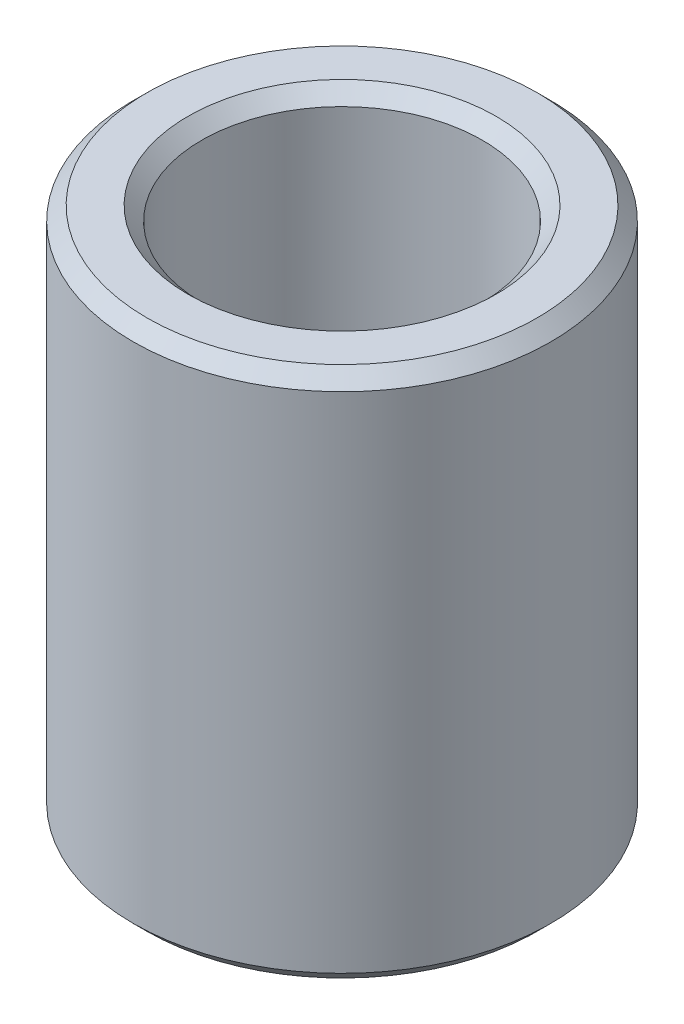
from build123d import *

# Parameters (mm, degrees)
SKETCH1_R           = 10
BOSS_EXTRUDE1_DEPTH = 25.432357876
SKETCH2_R           = 6.719081338
CUT_EXTRUDE1_DEPTH  = 30.099911119
CHAMFER1_SIZE       = 0.659512166


with BuildPart() as part:
    # Sketch1 → Boss-Extrude1 (new body)
    with BuildSketch(Plane(origin=(0, 0, 0), x_dir=(1, 0, 0), z_dir=(0, 1, 0))):
        Circle(SKETCH1_R)
    extrude(amount=BOSS_EXTRUDE1_DEPTH)

    # Sketch2 → Cut-Extrude1 (cut, through all)
    with BuildSketch(Plane(origin=(0, 0, 0), x_dir=(1, 0, 0), z_dir=(0, 1, 0))):
        Circle(SKETCH2_R)
    extrude(amount=CUT_EXTRUDE1_DEPTH, mode=Mode.SUBTRACT)

    # Chamfer1
    chamfer1_edges = [part.edges().sort_by_distance(p)[0] for p in [
        (-6.719081338, 25.432357876, 0),
        (-6.719081338, 0, 0),
        (-10, 0, 0),
        (-10, 25.432357876, 0),
    ]]
    chamfer(chamfer1_edges, length=CHAMFER1_SIZE)


solid = part.part
